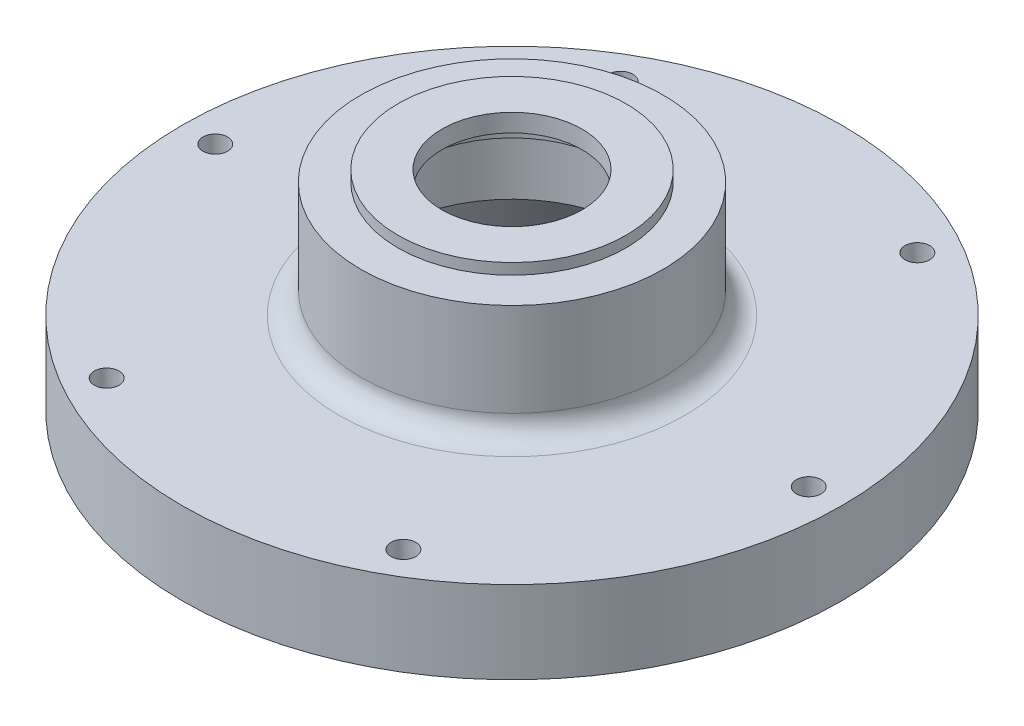
from build123d import *

# Parameters (mm, degrees)
SKETCH_3_R              = 1
CUT_EXTRUDE_1_DEPTH     = 184.766835963
SKETCH_4_W              = 12
SKETCH_4_H              = 2
HOLE_WIZARD_M8_1_REACH  = 230.003
HOLE_WIZARD_M8_1_BORE_R = 3.4
HOLE_START              = 11.5
HOLE_WIZARD_2_OUTLINE_R = 4.5
HOLE_WIZARD_2_DEPTH     = 30


# Read off the part's stored shape, not the designer's step: 孔2
with BuildPart() as part:
    # 草图1 → 旋转1 (revolve)
    with BuildSketch(Plane(origin=(0, 0, 0), x_dir=(0, 0, -1), z_dir=(1, 0, 0))):
        with BuildLine():
            Line((0, 0), (-99, 0))
            Line((-99, 0), (-99, 3.5))
            Line((-99, 3.5), (-95, 3.5))
            Line((-95, 3.5), (-95, 11.5))
            Line((-95, 11.5), (-120, 11.5))
            Line((-120, 11.5), (-120, 41.5))
            Line((-120, 41.5), (-63, 41.5))
            ThreePointArc((-63, 41.5), (-57.343145751, 43.843145751), (-55, 49.5))
            Line((-55, 49.5), (-55, 83.5))
            Line((-55, 83.5), (-41.5, 83.5))
            Line((-41.5, 83.5), (-41.5, 87.5))
            Line((-41.5, 87.5), (0, 87.5))
            Line((0, 87.5), (0, 0))
        make_face()
    revolve(axis=Axis((0, 87.5, 0), (0, -1, 0)))

    # 草图2 → 切除-旋转1 (revolve, cut)
    with BuildSketch(Plane(origin=(0, 0, 0), x_dir=(0, 0, -1), z_dir=(1, 0, 0))):
        Polygon((-89, 0), (-89, 29), (-55, 29), (-45, 46.320508076), (-45, 70.5), (-42, 70.5), (-42, 72), (-36, 72), (-36, 78.5), (-30, 78.5), (-30, 81), (-25.5, 81), (-25.5, 87.5), (0, 87.5), (0, 0), align=None)
    revolve(axis=Axis((0, 87.5, 0), (0, -1, 0)), mode=Mode.SUBTRACT)

    # 草图3 → 切除-拉伸1 (cut, through all)
    with BuildSketch(Plane.XZ.offset(-70.5)):
        with Locations((-45, 0)):
            Circle(SKETCH_3_R)
    extrude(amount=CUT_EXTRUDE_1_DEPTH, mode=Mode.SUBTRACT)

    # 草图4 → 孔1 (revolve, cut)
    with BuildSketch(Plane(origin=(-55, 59.5, 0), x_dir=(0, 0, 1), z_dir=(0, 1, 0))):
        with Locations((6, 1)):
            Rectangle(SKETCH_4_W, SKETCH_4_H)
    revolve(axis=Axis((55, 59.5, 0), (-1, 0, 0)), mode=Mode.SUBTRACT)

    # M8 螺纹孔1 bore → M8 螺纹孔1 (cut, up to next)
    with BuildSketch(Plane.ZY.offset(53), mode=Mode.PRIVATE) as hole_wizard_m8_1_sk1:
        with Locations((0, 59.5)):
            Circle(HOLE_WIZARD_M8_1_BORE_R)
    hole_wizard_m8_1_tool1 = extrude(hole_wizard_m8_1_sk1.sketch, amount=-HOLE_WIZARD_M8_1_REACH, mode=Mode.PRIVATE) & part.part
    add(hole_wizard_m8_1_tool1.solids().sort_by_distance((-53, 59.5, 0))[0], mode=Mode.SUBTRACT)

    # 孔2 outline → 孔2 (cut)
    with BuildSketch(Plane(origin=(0, 0, 0), x_dir=(1, 0, 0), z_dir=(0, 1, 0)).offset(HOLE_START)):
        with Locations((-54, 93.530743609)):
            Circle(HOLE_WIZARD_2_OUTLINE_R)
        with Locations((54, 93.530743609)):
            Circle(HOLE_WIZARD_2_OUTLINE_R)
        with Locations((108, 0)):
            Circle(HOLE_WIZARD_2_OUTLINE_R)
        with Locations((54, -93.530743609)):
            Circle(HOLE_WIZARD_2_OUTLINE_R)
        with Locations((-54, -93.530743609)):
            Circle(HOLE_WIZARD_2_OUTLINE_R)
        with Locations((-108, 0)):
            Circle(HOLE_WIZARD_2_OUTLINE_R)
    extrude(amount=HOLE_WIZARD_2_DEPTH, mode=Mode.SUBTRACT)


solid = part.part
